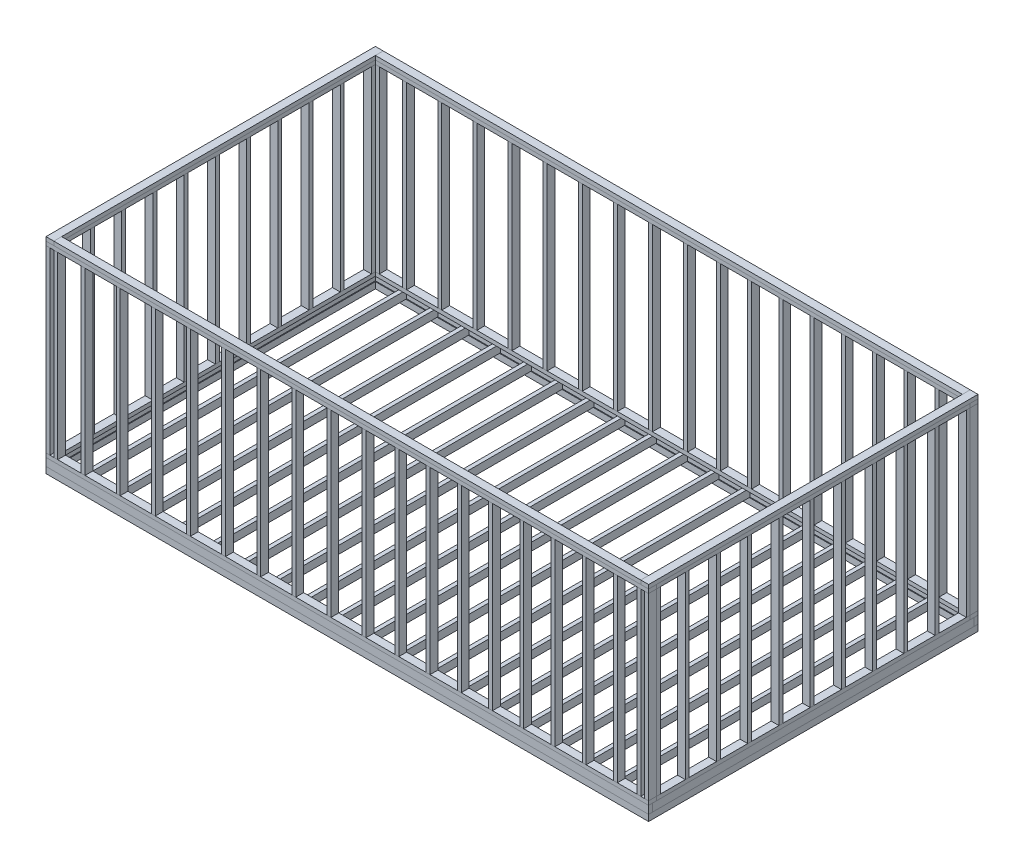
from build123d import *

# Parameters (mm, degrees)
METAL_FRAME_W          = 7720
METAL_FRAME_H          = 4220
METAL_FRAME_W_2        = 7600
METAL_FRAME_H_2        = 4100
BOSS_EXTRUDE1_DEPTH    = 80
SKETCH4_W              = 7720
SKETCH4_H              = 50
BOSS_EXTRUDE2_DEPTH    = 100
BOSS_EXTRUDE2_2_DEPTH  = 100
SKETCH4_3_W            = 50
SKETCH4_3_H            = 4120
BOSS_EXTRUDE3_DEPTH    = 100
BOSS_EXTRUDE3_2_DEPTH  = 100
LPATTERN1_COUNT        = 20
LPATTERN1_PITCH        = 400
SKETCH5_W              = 7720
SKETCH5_H              = 100
BOSS_EXTRUDE4_DEPTH    = 50
BOSS_EXTRUDE4_2_DEPTH  = 50
SKETCH5_4_W            = 100
SKETCH5_4_H            = 4020
BOSS_EXTRUDE5_DEPTH    = 50
BOSS_EXTRUDE5_2_DEPTH  = 50
SKETCH6_W              = 50
SKETCH6_H              = 100
BOSS_EXTRUDE6_DEPTH    = 2300
BOSS_EXTRUDE6_2_DEPTH  = 2300
BOSS_EXTRUDE6_3_DEPTH  = 2300
BOSS_EXTRUDE6_4_DEPTH  = 2300
BOSS_EXTRUDE6_5_DEPTH  = 2300
BOSS_EXTRUDE6_6_DEPTH  = 2300
BOSS_EXTRUDE6_7_DEPTH  = 2300
BOSS_EXTRUDE6_8_DEPTH  = 2300
BOSS_EXTRUDE6_9_DEPTH  = 2300
BOSS_EXTRUDE6_10_DEPTH = 2300
BOSS_EXTRUDE6_11_DEPTH = 2300
BOSS_EXTRUDE6_12_DEPTH = 2300
BOSS_EXTRUDE6_13_DEPTH = 2300
BOSS_EXTRUDE6_14_DEPTH = 2300
BOSS_EXTRUDE6_15_DEPTH = 2300
BOSS_EXTRUDE6_16_DEPTH = 2300
BOSS_EXTRUDE6_17_DEPTH = 2300
BOSS_EXTRUDE6_18_DEPTH = 2300
BOSS_EXTRUDE6_19_DEPTH = 2300
BOSS_EXTRUDE6_20_DEPTH = 2300
BOSS_EXTRUDE6_21_DEPTH = 2300
BOSS_EXTRUDE6_22_DEPTH = 2300
BOSS_EXTRUDE6_23_DEPTH = 2300
BOSS_EXTRUDE6_24_DEPTH = 2300
BOSS_EXTRUDE6_25_DEPTH = 2300
BOSS_EXTRUDE6_26_DEPTH = 2300
BOSS_EXTRUDE6_27_DEPTH = 2300
BOSS_EXTRUDE6_28_DEPTH = 2300
BOSS_EXTRUDE6_29_DEPTH = 2300
BOSS_EXTRUDE6_30_DEPTH = 2300
BOSS_EXTRUDE6_31_DEPTH = 2300
BOSS_EXTRUDE6_32_DEPTH = 2300
BOSS_EXTRUDE6_33_DEPTH = 2300
BOSS_EXTRUDE6_34_DEPTH = 2300
BOSS_EXTRUDE6_35_DEPTH = 2300
BOSS_EXTRUDE6_36_DEPTH = 2300
BOSS_EXTRUDE6_37_DEPTH = 2300
BOSS_EXTRUDE6_38_DEPTH = 2300
SKETCH7_W              = 100
SKETCH7_H              = 50
BOSS_EXTRUDE7_DEPTH    = 2300
BOSS_EXTRUDE7_2_DEPTH  = 2300
BOSS_EXTRUDE7_3_DEPTH  = 2300
BOSS_EXTRUDE7_4_DEPTH  = 2300
BOSS_EXTRUDE7_5_DEPTH  = 2300
BOSS_EXTRUDE7_6_DEPTH  = 2300
BOSS_EXTRUDE7_7_DEPTH  = 2300
BOSS_EXTRUDE7_8_DEPTH  = 2300
BOSS_EXTRUDE7_9_DEPTH  = 2300
BOSS_EXTRUDE7_10_DEPTH = 2300
BOSS_EXTRUDE7_11_DEPTH = 2300
BOSS_EXTRUDE7_12_DEPTH = 2300
BOSS_EXTRUDE7_13_DEPTH = 2300
BOSS_EXTRUDE7_14_DEPTH = 2300
BOSS_EXTRUDE7_15_DEPTH = 2300
BOSS_EXTRUDE7_16_DEPTH = 2300
BOSS_EXTRUDE7_17_DEPTH = 2300
BOSS_EXTRUDE7_18_DEPTH = 2300
BOSS_EXTRUDE7_19_DEPTH = 2300
BOSS_EXTRUDE7_20_DEPTH = 2300
SKETCH8_W              = 100
SKETCH8_H              = 50
BOSS_EXTRUDE8_DEPTH    = 2300
SKETCH8_W_2            = 50
SKETCH8_H_2            = 100
BOSS_EXTRUDE8_2_DEPTH  = 2300
BOSS_EXTRUDE8_3_DEPTH  = 2300
BOSS_EXTRUDE8_4_DEPTH  = 2300
BOSS_EXTRUDE8_5_DEPTH  = 2300
BOSS_EXTRUDE8_6_DEPTH  = 2300
SKETCH9_W              = 100
SKETCH9_H              = 4020
BOSS_EXTRUDE9_DEPTH    = 50
BOSS_EXTRUDE9_2_DEPTH  = 50
SKETCH10_W             = 7720
SKETCH10_H             = 100
BOSS_EXTRUDE10_DEPTH   = 50
BOSS_EXTRUDE10_2_DEPTH = 50
SKETCH11_W             = 100
SKETCH11_H             = 4220
BOSS_EXTRUDE11_DEPTH   = 50
BOSS_EXTRUDE11_2_DEPTH = 50
SKETCH11_3_W           = 7520
SKETCH11_3_H           = 100
BOSS_EXTRUDE12_DEPTH   = 50
SKETCH12_W             = 7520
SKETCH12_H             = 100
BOSS_EXTRUDE13_DEPTH   = 50


with BuildPart() as part:
    # Metal frame → Boss-Extrude1 (new body)
    with BuildSketch(Plane(origin=(0, 0, 0), x_dir=(1, 0, 0), z_dir=(0, 1, 0))):
        with Locations((3800, 2050)):
            Rectangle(METAL_FRAME_W, METAL_FRAME_H)
        with Locations((3800, 2050)):
            Rectangle(METAL_FRAME_W_2, METAL_FRAME_H_2, mode=Mode.SUBTRACT)
    extrude(amount=-BOSS_EXTRUDE1_DEPTH)


with BuildPart() as body_2:
    # Sketch4 → Boss-Extrude2 (new body)
    with BuildSketch(Plane(origin=(0, 0, 0), x_dir=(1, 0, 0), z_dir=(0, 1, 0))):
        with Locations((3800, 4135)):
            Rectangle(SKETCH4_W, SKETCH4_H)
    extrude(amount=BOSS_EXTRUDE2_DEPTH)


with BuildPart() as body_3:
    # Sketch4 → Boss-Extrude2 2 (new body)
    with BuildSketch(Plane(origin=(0, 0, 0), x_dir=(1, 0, 0), z_dir=(0, 1, 0))):
        with Locations((3800, -35)):
            Rectangle(SKETCH4_W, SKETCH4_H)
    extrude(amount=BOSS_EXTRUDE2_2_DEPTH)


with BuildPart() as body_4:
    # Sketch4<3> → Boss-Extrude3 (new body)
    with BuildSketch(Plane(origin=(0, 0, 0), x_dir=(1, 0, 0), z_dir=(0, 1, 0))):
        with Locations((-35, 2050)):
            Rectangle(SKETCH4_3_W, SKETCH4_3_H)
    extrude(amount=BOSS_EXTRUDE3_DEPTH)


with BuildPart() as body_5:
    # Sketch4<3> → Boss-Extrude3 2 (new body)
    with BuildSketch(Plane(origin=(0, 0, 0), x_dir=(1, 0, 0), z_dir=(0, 1, 0))):
        with Locations((7635, 2050)):
            Rectangle(SKETCH4_3_W, SKETCH4_3_H)
    extrude(amount=BOSS_EXTRUDE3_2_DEPTH)


with BuildPart() as lpattern1_1:
    # LPattern1: pattern copy
    add(body_4.part.moved(Location(Vector(1, 0, 0) * (1 * LPATTERN1_PITCH))))


with BuildPart() as lpattern1_2:
    # LPattern1: pattern copy
    add(body_4.part.moved(Location(Vector(1, 0, 0) * (2 * LPATTERN1_PITCH))))


with BuildPart() as lpattern1_3:
    # LPattern1: pattern copy
    add(body_4.part.moved(Location(Vector(1, 0, 0) * (3 * LPATTERN1_PITCH))))


with BuildPart() as lpattern1_4:
    # LPattern1: pattern copy
    add(body_4.part.moved(Location(Vector(1, 0, 0) * (4 * LPATTERN1_PITCH))))


with BuildPart() as lpattern1_5:
    # LPattern1: pattern copy
    add(body_4.part.moved(Location(Vector(1, 0, 0) * (5 * LPATTERN1_PITCH))))


with BuildPart() as lpattern1_6:
    # LPattern1: pattern copy
    add(body_4.part.moved(Location(Vector(1, 0, 0) * (6 * LPATTERN1_PITCH))))


with BuildPart() as lpattern1_7:
    # LPattern1: pattern copy
    add(body_4.part.moved(Location(Vector(1, 0, 0) * (7 * LPATTERN1_PITCH))))


with BuildPart() as lpattern1_8:
    # LPattern1: pattern copy
    add(body_4.part.moved(Location(Vector(1, 0, 0) * (8 * LPATTERN1_PITCH))))


with BuildPart() as lpattern1_9:
    # LPattern1: pattern copy
    add(body_4.part.moved(Location(Vector(1, 0, 0) * (9 * LPATTERN1_PITCH))))


with BuildPart() as lpattern1_10:
    # LPattern1: pattern copy
    add(body_4.part.moved(Location(Vector(1, 0, 0) * (10 * LPATTERN1_PITCH))))


with BuildPart() as lpattern1_11:
    # LPattern1: pattern copy
    add(body_4.part.moved(Location(Vector(1, 0, 0) * (11 * LPATTERN1_PITCH))))


with BuildPart() as lpattern1_12:
    # LPattern1: pattern copy
    add(body_4.part.moved(Location(Vector(1, 0, 0) * (12 * LPATTERN1_PITCH))))


with BuildPart() as lpattern1_13:
    # LPattern1: pattern copy
    add(body_4.part.moved(Location(Vector(1, 0, 0) * (13 * LPATTERN1_PITCH))))


with BuildPart() as lpattern1_14:
    # LPattern1: pattern copy
    add(body_4.part.moved(Location(Vector(1, 0, 0) * (14 * LPATTERN1_PITCH))))


with BuildPart() as lpattern1_15:
    # LPattern1: pattern copy
    add(body_4.part.moved(Location(Vector(1, 0, 0) * (15 * LPATTERN1_PITCH))))


with BuildPart() as lpattern1_16:
    # LPattern1: pattern copy
    add(body_4.part.moved(Location(Vector(1, 0, 0) * (16 * LPATTERN1_PITCH))))


with BuildPart() as lpattern1_17:
    # LPattern1: pattern copy
    add(body_4.part.moved(Location(Vector(1, 0, 0) * (17 * LPATTERN1_PITCH))))


with BuildPart() as lpattern1_18:
    # LPattern1: pattern copy
    add(body_4.part.moved(Location(Vector(1, 0, 0) * (18 * LPATTERN1_PITCH))))


with BuildPart() as lpattern1_19:
    # LPattern1: pattern copy
    add(body_4.part.moved(Location(Vector(1, 0, 0) * (19 * LPATTERN1_PITCH))))


with BuildPart() as body_25:
    # Sketch5 → Boss-Extrude4 (new body)
    with BuildSketch(Plane(origin=(0, 100, 0), x_dir=(1, 0, 0), z_dir=(0, 1, 0))):
        with Locations((3800, 4110)):
            Rectangle(SKETCH5_W, SKETCH5_H)
    extrude(amount=BOSS_EXTRUDE4_DEPTH)


with BuildPart() as body_26:
    # Sketch5 → Boss-Extrude4 2 (new body)
    with BuildSketch(Plane(origin=(0, 100, 0), x_dir=(1, 0, 0), z_dir=(0, 1, 0))):
        with Locations((3800, -10)):
            Rectangle(SKETCH5_W, SKETCH5_H)
    extrude(amount=BOSS_EXTRUDE4_2_DEPTH)


with BuildPart() as body_27:
    # Sketch5<4> → Boss-Extrude5 (new body)
    with BuildSketch(Plane(origin=(0, 100, 0), x_dir=(1, 0, 0), z_dir=(0, 1, 0))):
        with Locations((-10, 2050)):
            Rectangle(SKETCH5_4_W, SKETCH5_4_H)
    extrude(amount=BOSS_EXTRUDE5_DEPTH)


with BuildPart() as body_28:
    # Sketch5<4> → Boss-Extrude5 2 (new body)
    with BuildSketch(Plane(origin=(0, 100, 0), x_dir=(1, 0, 0), z_dir=(0, 1, 0))):
        with Locations((7610, 2050)):
            Rectangle(SKETCH5_4_W, SKETCH5_4_H)
    extrude(amount=BOSS_EXTRUDE5_2_DEPTH)


with BuildPart() as body_29:
    # Sketch6 → Boss-Extrude6 (new body)
    with BuildSketch(Plane(origin=(0, 150, 0), x_dir=(1, 0, 0), z_dir=(0, 1, 0))):
        with Locations((-35, -10)):
            Rectangle(SKETCH6_W, SKETCH6_H)
    extrude(amount=BOSS_EXTRUDE6_DEPTH)


with BuildPart() as body_30:
    # Sketch6 → Boss-Extrude6 2 (new body)
    with BuildSketch(Plane(origin=(0, 150, 0), x_dir=(1, 0, 0), z_dir=(0, 1, 0))):
        with Locations((-35, 4110)):
            Rectangle(SKETCH6_W, SKETCH6_H)
    extrude(amount=BOSS_EXTRUDE6_2_DEPTH)


with BuildPart() as body_31:
    # Sketch6 → Boss-Extrude6 3 (new body)
    with BuildSketch(Plane(origin=(0, 150, 0), x_dir=(1, 0, 0), z_dir=(0, 1, 0))):
        with Locations((415, -10)):
            Rectangle(SKETCH6_W, SKETCH6_H)
    extrude(amount=BOSS_EXTRUDE6_3_DEPTH)


with BuildPart() as body_32:
    # Sketch6 → Boss-Extrude6 4 (new body)
    with BuildSketch(Plane(origin=(0, 150, 0), x_dir=(1, 0, 0), z_dir=(0, 1, 0))):
        with Locations((415, 4110)):
            Rectangle(SKETCH6_W, SKETCH6_H)
    extrude(amount=BOSS_EXTRUDE6_4_DEPTH)


with BuildPart() as body_33:
    # Sketch6 → Boss-Extrude6 5 (new body)
    with BuildSketch(Plane(origin=(0, 150, 0), x_dir=(1, 0, 0), z_dir=(0, 1, 0))):
        with Locations((865, -10)):
            Rectangle(SKETCH6_W, SKETCH6_H)
    extrude(amount=BOSS_EXTRUDE6_5_DEPTH)


with BuildPart() as body_34:
    # Sketch6 → Boss-Extrude6 6 (new body)
    with BuildSketch(Plane(origin=(0, 150, 0), x_dir=(1, 0, 0), z_dir=(0, 1, 0))):
        with Locations((865, 4110)):
            Rectangle(SKETCH6_W, SKETCH6_H)
    extrude(amount=BOSS_EXTRUDE6_6_DEPTH)


with BuildPart() as body_35:
    # Sketch6 → Boss-Extrude6 7 (new body)
    with BuildSketch(Plane(origin=(0, 150, 0), x_dir=(1, 0, 0), z_dir=(0, 1, 0))):
        with Locations((1315, -10)):
            Rectangle(SKETCH6_W, SKETCH6_H)
    extrude(amount=BOSS_EXTRUDE6_7_DEPTH)


with BuildPart() as body_36:
    # Sketch6 → Boss-Extrude6 8 (new body)
    with BuildSketch(Plane(origin=(0, 150, 0), x_dir=(1, 0, 0), z_dir=(0, 1, 0))):
        with Locations((1315, 4110)):
            Rectangle(SKETCH6_W, SKETCH6_H)
    extrude(amount=BOSS_EXTRUDE6_8_DEPTH)


with BuildPart() as body_37:
    # Sketch6 → Boss-Extrude6 9 (new body)
    with BuildSketch(Plane(origin=(0, 150, 0), x_dir=(1, 0, 0), z_dir=(0, 1, 0))):
        with Locations((1765, -10)):
            Rectangle(SKETCH6_W, SKETCH6_H)
    extrude(amount=BOSS_EXTRUDE6_9_DEPTH)


with BuildPart() as body_38:
    # Sketch6 → Boss-Extrude6 10 (new body)
    with BuildSketch(Plane(origin=(0, 150, 0), x_dir=(1, 0, 0), z_dir=(0, 1, 0))):
        with Locations((1765, 4110)):
            Rectangle(SKETCH6_W, SKETCH6_H)
    extrude(amount=BOSS_EXTRUDE6_10_DEPTH)


with BuildPart() as body_39:
    # Sketch6 → Boss-Extrude6 11 (new body)
    with BuildSketch(Plane(origin=(0, 150, 0), x_dir=(1, 0, 0), z_dir=(0, 1, 0))):
        with Locations((2215, -10)):
            Rectangle(SKETCH6_W, SKETCH6_H)
    extrude(amount=BOSS_EXTRUDE6_11_DEPTH)


with BuildPart() as body_40:
    # Sketch6 → Boss-Extrude6 12 (new body)
    with BuildSketch(Plane(origin=(0, 150, 0), x_dir=(1, 0, 0), z_dir=(0, 1, 0))):
        with Locations((2215, 4110)):
            Rectangle(SKETCH6_W, SKETCH6_H)
    extrude(amount=BOSS_EXTRUDE6_12_DEPTH)


with BuildPart() as body_41:
    # Sketch6 → Boss-Extrude6 13 (new body)
    with BuildSketch(Plane(origin=(0, 150, 0), x_dir=(1, 0, 0), z_dir=(0, 1, 0))):
        with Locations((2665, -10)):
            Rectangle(SKETCH6_W, SKETCH6_H)
    extrude(amount=BOSS_EXTRUDE6_13_DEPTH)


with BuildPart() as body_42:
    # Sketch6 → Boss-Extrude6 14 (new body)
    with BuildSketch(Plane(origin=(0, 150, 0), x_dir=(1, 0, 0), z_dir=(0, 1, 0))):
        with Locations((2665, 4110)):
            Rectangle(SKETCH6_W, SKETCH6_H)
    extrude(amount=BOSS_EXTRUDE6_14_DEPTH)


with BuildPart() as body_43:
    # Sketch6 → Boss-Extrude6 15 (new body)
    with BuildSketch(Plane(origin=(0, 150, 0), x_dir=(1, 0, 0), z_dir=(0, 1, 0))):
        with Locations((3115, -10)):
            Rectangle(SKETCH6_W, SKETCH6_H)
    extrude(amount=BOSS_EXTRUDE6_15_DEPTH)


with BuildPart() as body_44:
    # Sketch6 → Boss-Extrude6 16 (new body)
    with BuildSketch(Plane(origin=(0, 150, 0), x_dir=(1, 0, 0), z_dir=(0, 1, 0))):
        with Locations((3115, 4110)):
            Rectangle(SKETCH6_W, SKETCH6_H)
    extrude(amount=BOSS_EXTRUDE6_16_DEPTH)


with BuildPart() as body_45:
    # Sketch6 → Boss-Extrude6 17 (new body)
    with BuildSketch(Plane(origin=(0, 150, 0), x_dir=(1, 0, 0), z_dir=(0, 1, 0))):
        with Locations((3565, -10)):
            Rectangle(SKETCH6_W, SKETCH6_H)
    extrude(amount=BOSS_EXTRUDE6_17_DEPTH)


with BuildPart() as body_46:
    # Sketch6 → Boss-Extrude6 18 (new body)
    with BuildSketch(Plane(origin=(0, 150, 0), x_dir=(1, 0, 0), z_dir=(0, 1, 0))):
        with Locations((3565, 4110)):
            Rectangle(SKETCH6_W, SKETCH6_H)
    extrude(amount=BOSS_EXTRUDE6_18_DEPTH)


with BuildPart() as body_47:
    # Sketch6 → Boss-Extrude6 19 (new body)
    with BuildSketch(Plane(origin=(0, 150, 0), x_dir=(1, 0, 0), z_dir=(0, 1, 0))):
        with Locations((4015, -10)):
            Rectangle(SKETCH6_W, SKETCH6_H)
    extrude(amount=BOSS_EXTRUDE6_19_DEPTH)


with BuildPart() as body_48:
    # Sketch6 → Boss-Extrude6 20 (new body)
    with BuildSketch(Plane(origin=(0, 150, 0), x_dir=(1, 0, 0), z_dir=(0, 1, 0))):
        with Locations((4015, 4110)):
            Rectangle(SKETCH6_W, SKETCH6_H)
    extrude(amount=BOSS_EXTRUDE6_20_DEPTH)


with BuildPart() as body_49:
    # Sketch6 → Boss-Extrude6 21 (new body)
    with BuildSketch(Plane(origin=(0, 150, 0), x_dir=(1, 0, 0), z_dir=(0, 1, 0))):
        with Locations((7635, 4110)):
            Rectangle(SKETCH6_W, SKETCH6_H)
    extrude(amount=BOSS_EXTRUDE6_21_DEPTH)


with BuildPart() as body_50:
    # Sketch6 → Boss-Extrude6 22 (new body)
    with BuildSketch(Plane(origin=(0, 150, 0), x_dir=(1, 0, 0), z_dir=(0, 1, 0))):
        with Locations((7635, -10)):
            Rectangle(SKETCH6_W, SKETCH6_H)
    extrude(amount=BOSS_EXTRUDE6_22_DEPTH)


with BuildPart() as body_51:
    # Sketch6 → Boss-Extrude6 23 (new body)
    with BuildSketch(Plane(origin=(0, 150, 0), x_dir=(1, 0, 0), z_dir=(0, 1, 0))):
        with Locations((7235, -10)):
            Rectangle(SKETCH6_W, SKETCH6_H)
    extrude(amount=BOSS_EXTRUDE6_23_DEPTH)


with BuildPart() as body_52:
    # Sketch6 → Boss-Extrude6 24 (new body)
    with BuildSketch(Plane(origin=(0, 150, 0), x_dir=(1, 0, 0), z_dir=(0, 1, 0))):
        with Locations((7235, 4110)):
            Rectangle(SKETCH6_W, SKETCH6_H)
    extrude(amount=BOSS_EXTRUDE6_24_DEPTH)


with BuildPart() as body_53:
    # Sketch6 → Boss-Extrude6 25 (new body)
    with BuildSketch(Plane(origin=(0, 150, 0), x_dir=(1, 0, 0), z_dir=(0, 1, 0))):
        with Locations((6835, -10)):
            Rectangle(SKETCH6_W, SKETCH6_H)
    extrude(amount=BOSS_EXTRUDE6_25_DEPTH)


with BuildPart() as body_54:
    # Sketch6 → Boss-Extrude6 26 (new body)
    with BuildSketch(Plane(origin=(0, 150, 0), x_dir=(1, 0, 0), z_dir=(0, 1, 0))):
        with Locations((6835, 4110)):
            Rectangle(SKETCH6_W, SKETCH6_H)
    extrude(amount=BOSS_EXTRUDE6_26_DEPTH)


with BuildPart() as body_55:
    # Sketch6 → Boss-Extrude6 27 (new body)
    with BuildSketch(Plane(origin=(0, 150, 0), x_dir=(1, 0, 0), z_dir=(0, 1, 0))):
        with Locations((6435, -10)):
            Rectangle(SKETCH6_W, SKETCH6_H)
    extrude(amount=BOSS_EXTRUDE6_27_DEPTH)


with BuildPart() as body_56:
    # Sketch6 → Boss-Extrude6 28 (new body)
    with BuildSketch(Plane(origin=(0, 150, 0), x_dir=(1, 0, 0), z_dir=(0, 1, 0))):
        with Locations((6435, 4110)):
            Rectangle(SKETCH6_W, SKETCH6_H)
    extrude(amount=BOSS_EXTRUDE6_28_DEPTH)


with BuildPart() as body_57:
    # Sketch6 → Boss-Extrude6 29 (new body)
    with BuildSketch(Plane(origin=(0, 150, 0), x_dir=(1, 0, 0), z_dir=(0, 1, 0))):
        with Locations((6035, -10)):
            Rectangle(SKETCH6_W, SKETCH6_H)
    extrude(amount=BOSS_EXTRUDE6_29_DEPTH)


with BuildPart() as body_58:
    # Sketch6 → Boss-Extrude6 30 (new body)
    with BuildSketch(Plane(origin=(0, 150, 0), x_dir=(1, 0, 0), z_dir=(0, 1, 0))):
        with Locations((6035, 4110)):
            Rectangle(SKETCH6_W, SKETCH6_H)
    extrude(amount=BOSS_EXTRUDE6_30_DEPTH)


with BuildPart() as body_59:
    # Sketch6 → Boss-Extrude6 31 (new body)
    with BuildSketch(Plane(origin=(0, 150, 0), x_dir=(1, 0, 0), z_dir=(0, 1, 0))):
        with Locations((5635, -10)):
            Rectangle(SKETCH6_W, SKETCH6_H)
    extrude(amount=BOSS_EXTRUDE6_31_DEPTH)


with BuildPart() as body_60:
    # Sketch6 → Boss-Extrude6 32 (new body)
    with BuildSketch(Plane(origin=(0, 150, 0), x_dir=(1, 0, 0), z_dir=(0, 1, 0))):
        with Locations((5635, 4110)):
            Rectangle(SKETCH6_W, SKETCH6_H)
    extrude(amount=BOSS_EXTRUDE6_32_DEPTH)


with BuildPart() as body_61:
    # Sketch6 → Boss-Extrude6 33 (new body)
    with BuildSketch(Plane(origin=(0, 150, 0), x_dir=(1, 0, 0), z_dir=(0, 1, 0))):
        with Locations((5235, -10)):
            Rectangle(SKETCH6_W, SKETCH6_H)
    extrude(amount=BOSS_EXTRUDE6_33_DEPTH)


with BuildPart() as body_62:
    # Sketch6 → Boss-Extrude6 34 (new body)
    with BuildSketch(Plane(origin=(0, 150, 0), x_dir=(1, 0, 0), z_dir=(0, 1, 0))):
        with Locations((5235, 4110)):
            Rectangle(SKETCH6_W, SKETCH6_H)
    extrude(amount=BOSS_EXTRUDE6_34_DEPTH)


with BuildPart() as body_63:
    # Sketch6 → Boss-Extrude6 35 (new body)
    with BuildSketch(Plane(origin=(0, 150, 0), x_dir=(1, 0, 0), z_dir=(0, 1, 0))):
        with Locations((4835, -10)):
            Rectangle(SKETCH6_W, SKETCH6_H)
    extrude(amount=BOSS_EXTRUDE6_35_DEPTH)


with BuildPart() as body_64:
    # Sketch6 → Boss-Extrude6 36 (new body)
    with BuildSketch(Plane(origin=(0, 150, 0), x_dir=(1, 0, 0), z_dir=(0, 1, 0))):
        with Locations((4835, 4110)):
            Rectangle(SKETCH6_W, SKETCH6_H)
    extrude(amount=BOSS_EXTRUDE6_36_DEPTH)


with BuildPart() as body_65:
    # Sketch6 → Boss-Extrude6 37 (new body)
    with BuildSketch(Plane(origin=(0, 150, 0), x_dir=(1, 0, 0), z_dir=(0, 1, 0))):
        with Locations((4435, -10)):
            Rectangle(SKETCH6_W, SKETCH6_H)
    extrude(amount=BOSS_EXTRUDE6_37_DEPTH)


with BuildPart() as body_66:
    # Sketch6 → Boss-Extrude6 38 (new body)
    with BuildSketch(Plane(origin=(0, 150, 0), x_dir=(1, 0, 0), z_dir=(0, 1, 0))):
        with Locations((4435, 4110)):
            Rectangle(SKETCH6_W, SKETCH6_H)
    extrude(amount=BOSS_EXTRUDE6_38_DEPTH)


with BuildPart() as body_67:
    # Sketch7 → Boss-Extrude7 (new body)
    with BuildSketch(Plane(origin=(0, 150, 0), x_dir=(1, 0, 0), z_dir=(0, 1, 0))):
        with Locations((-10, 4035)):
            Rectangle(SKETCH7_W, SKETCH7_H)
    extrude(amount=BOSS_EXTRUDE7_DEPTH)


with BuildPart() as body_68:
    # Sketch7 → Boss-Extrude7 2 (new body)
    with BuildSketch(Plane(origin=(0, 150, 0), x_dir=(1, 0, 0), z_dir=(0, 1, 0))):
        with Locations((7610, 4035)):
            Rectangle(SKETCH7_W, SKETCH7_H)
    extrude(amount=BOSS_EXTRUDE7_2_DEPTH)


with BuildPart() as body_69:
    # Sketch7 → Boss-Extrude7 3 (new body)
    with BuildSketch(Plane(origin=(0, 150, 0), x_dir=(1, 0, 0), z_dir=(0, 1, 0))):
        with Locations((-10, 3635)):
            Rectangle(SKETCH7_W, SKETCH7_H)
    extrude(amount=BOSS_EXTRUDE7_3_DEPTH)


with BuildPart() as body_70:
    # Sketch7 → Boss-Extrude7 4 (new body)
    with BuildSketch(Plane(origin=(0, 150, 0), x_dir=(1, 0, 0), z_dir=(0, 1, 0))):
        with Locations((7610, 3635)):
            Rectangle(SKETCH7_W, SKETCH7_H)
    extrude(amount=BOSS_EXTRUDE7_4_DEPTH)


with BuildPart() as body_71:
    # Sketch7 → Boss-Extrude7 5 (new body)
    with BuildSketch(Plane(origin=(0, 150, 0), x_dir=(1, 0, 0), z_dir=(0, 1, 0))):
        with Locations((-10, 3235)):
            Rectangle(SKETCH7_W, SKETCH7_H)
    extrude(amount=BOSS_EXTRUDE7_5_DEPTH)


with BuildPart() as body_72:
    # Sketch7 → Boss-Extrude7 6 (new body)
    with BuildSketch(Plane(origin=(0, 150, 0), x_dir=(1, 0, 0), z_dir=(0, 1, 0))):
        with Locations((7610, 3235)):
            Rectangle(SKETCH7_W, SKETCH7_H)
    extrude(amount=BOSS_EXTRUDE7_6_DEPTH)


with BuildPart() as body_73:
    # Sketch7 → Boss-Extrude7 7 (new body)
    with BuildSketch(Plane(origin=(0, 150, 0), x_dir=(1, 0, 0), z_dir=(0, 1, 0))):
        with Locations((-10, 2835)):
            Rectangle(SKETCH7_W, SKETCH7_H)
    extrude(amount=BOSS_EXTRUDE7_7_DEPTH)


with BuildPart() as body_74:
    # Sketch7 → Boss-Extrude7 8 (new body)
    with BuildSketch(Plane(origin=(0, 150, 0), x_dir=(1, 0, 0), z_dir=(0, 1, 0))):
        with Locations((7610, 2835)):
            Rectangle(SKETCH7_W, SKETCH7_H)
    extrude(amount=BOSS_EXTRUDE7_8_DEPTH)


with BuildPart() as body_75:
    # Sketch7 → Boss-Extrude7 9 (new body)
    with BuildSketch(Plane(origin=(0, 150, 0), x_dir=(1, 0, 0), z_dir=(0, 1, 0))):
        with Locations((-10, 2435)):
            Rectangle(SKETCH7_W, SKETCH7_H)
    extrude(amount=BOSS_EXTRUDE7_9_DEPTH)


with BuildPart() as body_76:
    # Sketch7 → Boss-Extrude7 10 (new body)
    with BuildSketch(Plane(origin=(0, 150, 0), x_dir=(1, 0, 0), z_dir=(0, 1, 0))):
        with Locations((7610, 2435)):
            Rectangle(SKETCH7_W, SKETCH7_H)
    extrude(amount=BOSS_EXTRUDE7_10_DEPTH)


with BuildPart() as body_77:
    # Sketch7 → Boss-Extrude7 11 (new body)
    with BuildSketch(Plane(origin=(0, 150, 0), x_dir=(1, 0, 0), z_dir=(0, 1, 0))):
        with Locations((-10, 2035)):
            Rectangle(SKETCH7_W, SKETCH7_H)
    extrude(amount=BOSS_EXTRUDE7_11_DEPTH)


with BuildPart() as body_78:
    # Sketch7 → Boss-Extrude7 12 (new body)
    with BuildSketch(Plane(origin=(0, 150, 0), x_dir=(1, 0, 0), z_dir=(0, 1, 0))):
        with Locations((7610, 2035)):
            Rectangle(SKETCH7_W, SKETCH7_H)
    extrude(amount=BOSS_EXTRUDE7_12_DEPTH)


with BuildPart() as body_79:
    # Sketch7 → Boss-Extrude7 13 (new body)
    with BuildSketch(Plane(origin=(0, 150, 0), x_dir=(1, 0, 0), z_dir=(0, 1, 0))):
        with Locations((-10, 1635)):
            Rectangle(SKETCH7_W, SKETCH7_H)
    extrude(amount=BOSS_EXTRUDE7_13_DEPTH)


with BuildPart() as body_80:
    # Sketch7 → Boss-Extrude7 14 (new body)
    with BuildSketch(Plane(origin=(0, 150, 0), x_dir=(1, 0, 0), z_dir=(0, 1, 0))):
        with Locations((7610, 1635)):
            Rectangle(SKETCH7_W, SKETCH7_H)
    extrude(amount=BOSS_EXTRUDE7_14_DEPTH)


with BuildPart() as body_81:
    # Sketch7 → Boss-Extrude7 15 (new body)
    with BuildSketch(Plane(origin=(0, 150, 0), x_dir=(1, 0, 0), z_dir=(0, 1, 0))):
        with Locations((-10, 1235)):
            Rectangle(SKETCH7_W, SKETCH7_H)
    extrude(amount=BOSS_EXTRUDE7_15_DEPTH)


with BuildPart() as body_82:
    # Sketch7 → Boss-Extrude7 16 (new body)
    with BuildSketch(Plane(origin=(0, 150, 0), x_dir=(1, 0, 0), z_dir=(0, 1, 0))):
        with Locations((7610, 1235)):
            Rectangle(SKETCH7_W, SKETCH7_H)
    extrude(amount=BOSS_EXTRUDE7_16_DEPTH)


with BuildPart() as body_83:
    # Sketch7 → Boss-Extrude7 17 (new body)
    with BuildSketch(Plane(origin=(0, 150, 0), x_dir=(1, 0, 0), z_dir=(0, 1, 0))):
        with Locations((-10, 835)):
            Rectangle(SKETCH7_W, SKETCH7_H)
    extrude(amount=BOSS_EXTRUDE7_17_DEPTH)


with BuildPart() as body_84:
    # Sketch7 → Boss-Extrude7 18 (new body)
    with BuildSketch(Plane(origin=(0, 150, 0), x_dir=(1, 0, 0), z_dir=(0, 1, 0))):
        with Locations((7610, 835)):
            Rectangle(SKETCH7_W, SKETCH7_H)
    extrude(amount=BOSS_EXTRUDE7_18_DEPTH)


with BuildPart() as body_85:
    # Sketch7 → Boss-Extrude7 19 (new body)
    with BuildSketch(Plane(origin=(0, 150, 0), x_dir=(1, 0, 0), z_dir=(0, 1, 0))):
        with Locations((-10, 435)):
            Rectangle(SKETCH7_W, SKETCH7_H)
    extrude(amount=BOSS_EXTRUDE7_19_DEPTH)


with BuildPart() as body_86:
    # Sketch7 → Boss-Extrude7 20 (new body)
    with BuildSketch(Plane(origin=(0, 150, 0), x_dir=(1, 0, 0), z_dir=(0, 1, 0))):
        with Locations((7610, 435)):
            Rectangle(SKETCH7_W, SKETCH7_H)
    extrude(amount=BOSS_EXTRUDE7_20_DEPTH)


with BuildPart() as body_87:
    # Sketch8 → Boss-Extrude8 (new body)
    with BuildSketch(Plane(origin=(0, 150, 0), x_dir=(1, 0, 0), z_dir=(0, 1, 0))):
        with Locations((-10, 65)):
            Rectangle(SKETCH8_W, SKETCH8_H)
    extrude(amount=BOSS_EXTRUDE8_DEPTH)


with BuildPart() as body_88:
    # Sketch8 → Boss-Extrude8 2 (new body)
    with BuildSketch(Plane(origin=(0, 150, 0), x_dir=(1, 0, 0), z_dir=(0, 1, 0))):
        with Locations((65, 4110)):
            Rectangle(SKETCH8_W_2, SKETCH8_H_2)
    extrude(amount=BOSS_EXTRUDE8_2_DEPTH)


with BuildPart() as body_89:
    # Sketch8 → Boss-Extrude8 3 (new body)
    with BuildSketch(Plane(origin=(0, 150, 0), x_dir=(1, 0, 0), z_dir=(0, 1, 0))):
        with Locations((65, -10)):
            Rectangle(SKETCH8_W_2, SKETCH8_H_2)
    extrude(amount=BOSS_EXTRUDE8_3_DEPTH)


with BuildPart() as body_90:
    # Sketch8 → Boss-Extrude8 4 (new body)
    with BuildSketch(Plane(origin=(0, 150, 0), x_dir=(1, 0, 0), z_dir=(0, 1, 0))):
        with Locations((7535, -10)):
            Rectangle(SKETCH8_W_2, SKETCH8_H_2)
    extrude(amount=BOSS_EXTRUDE8_4_DEPTH)


with BuildPart() as body_91:
    # Sketch8 → Boss-Extrude8 5 (new body)
    with BuildSketch(Plane(origin=(0, 150, 0), x_dir=(1, 0, 0), z_dir=(0, 1, 0))):
        with Locations((7610, 65)):
            Rectangle(SKETCH8_W, SKETCH8_H)
    extrude(amount=BOSS_EXTRUDE8_5_DEPTH)


with BuildPart() as body_92:
    # Sketch8 → Boss-Extrude8 6 (new body)
    with BuildSketch(Plane(origin=(0, 150, 0), x_dir=(1, 0, 0), z_dir=(0, 1, 0))):
        with Locations((7535, 4110)):
            Rectangle(SKETCH8_W_2, SKETCH8_H_2)
    extrude(amount=BOSS_EXTRUDE8_6_DEPTH)


with BuildPart() as body_93:
    # Sketch9 → Boss-Extrude9 (new body)
    with BuildSketch(Plane(origin=(0, 2450, 0), x_dir=(1, 0, 0), z_dir=(0, 1, 0))):
        with Locations((-10, 2050)):
            Rectangle(SKETCH9_W, SKETCH9_H)
    extrude(amount=BOSS_EXTRUDE9_DEPTH)


with BuildPart() as body_94:
    # Sketch9 → Boss-Extrude9 2 (new body)
    with BuildSketch(Plane(origin=(0, 2450, 0), x_dir=(1, 0, 0), z_dir=(0, 1, 0))):
        with Locations((7610, 2050)):
            Rectangle(SKETCH9_W, SKETCH9_H)
    extrude(amount=BOSS_EXTRUDE9_2_DEPTH)


with BuildPart() as body_95:
    # Sketch10 → Boss-Extrude10 (new body)
    with BuildSketch(Plane(origin=(0, 2450, 0), x_dir=(1, 0, 0), z_dir=(0, 1, 0))):
        with Locations((3800, 4110)):
            Rectangle(SKETCH10_W, SKETCH10_H)
    extrude(amount=BOSS_EXTRUDE10_DEPTH)


with BuildPart() as body_96:
    # Sketch10 → Boss-Extrude10 2 (new body)
    with BuildSketch(Plane(origin=(0, 2450, 0), x_dir=(1, 0, 0), z_dir=(0, 1, 0))):
        with Locations((3800, -10)):
            Rectangle(SKETCH10_W, SKETCH10_H)
    extrude(amount=BOSS_EXTRUDE10_2_DEPTH)


with BuildPart() as body_97:
    # Sketch11 → Boss-Extrude11 (new body)
    with BuildSketch(Plane(origin=(0, 2500, 0), x_dir=(1, 0, 0), z_dir=(0, 1, 0))):
        with Locations((-10, 2050)):
            Rectangle(SKETCH11_W, SKETCH11_H)
    extrude(amount=BOSS_EXTRUDE11_DEPTH)


with BuildPart() as body_98:
    # Sketch11 → Boss-Extrude11 2 (new body)
    with BuildSketch(Plane(origin=(0, 2500, 0), x_dir=(1, 0, 0), z_dir=(0, 1, 0))):
        with Locations((7610, 2050)):
            Rectangle(SKETCH11_W, SKETCH11_H)
    extrude(amount=BOSS_EXTRUDE11_2_DEPTH)


with BuildPart() as body_99:
    # Sketch11<3> → Boss-Extrude12 (new body)
    with BuildSketch(Plane(origin=(0, 2500, 0), x_dir=(1, 0, 0), z_dir=(0, 1, 0))):
        with Locations((3800, 4110)):
            Rectangle(SKETCH11_3_W, SKETCH11_3_H)
    extrude(amount=BOSS_EXTRUDE12_DEPTH)


with BuildPart() as body_100:
    # Sketch12 → Boss-Extrude13 (new body)
    with BuildSketch(Plane(origin=(0, 2500, 0), x_dir=(1, 0, 0), z_dir=(0, 1, 0))):
        with Locations((3800, -10)):
            Rectangle(SKETCH12_W, SKETCH12_H)
    extrude(amount=BOSS_EXTRUDE13_DEPTH)


solid = Compound([part.part, body_2.part, body_3.part, body_4.part, body_5.part, lpattern1_1.part, lpattern1_2.part, lpattern1_3.part, lpattern1_4.part, lpattern1_5.part, lpattern1_6.part, lpattern1_7.part, lpattern1_8.part, lpattern1_9.part, lpattern1_10.part, lpattern1_11.part, lpattern1_12.part, lpattern1_13.part, lpattern1_14.part, lpattern1_15.part, lpattern1_16.part, lpattern1_17.part, lpattern1_18.part, lpattern1_19.part, body_25.part, body_26.part, body_27.part, body_28.part, body_29.part, body_30.part, body_31.part, body_32.part, body_33.part, body_34.part, body_35.part, body_36.part, body_37.part, body_38.part, body_39.part, body_40.part, body_41.part, body_42.part, body_43.part, body_44.part, body_45.part, body_46.part, body_47.part, body_48.part, body_49.part, body_50.part, body_51.part, body_52.part, body_53.part, body_54.part, body_55.part, body_56.part, body_57.part, body_58.part, body_59.part, body_60.part, body_61.part, body_62.part, body_63.part, body_64.part, body_65.part, body_66.part, body_67.part, body_68.part, body_69.part, body_70.part, body_71.part, body_72.part, body_73.part, body_74.part, body_75.part, body_76.part, body_77.part, body_78.part, body_79.part, body_80.part, body_81.part, body_82.part, body_83.part, body_84.part, body_85.part, body_86.part, body_87.part, body_88.part, body_89.part, body_90.part, body_91.part, body_92.part, body_93.part, body_94.part, body_95.part, body_96.part, body_97.part, body_98.part, body_99.part, body_100.part])
